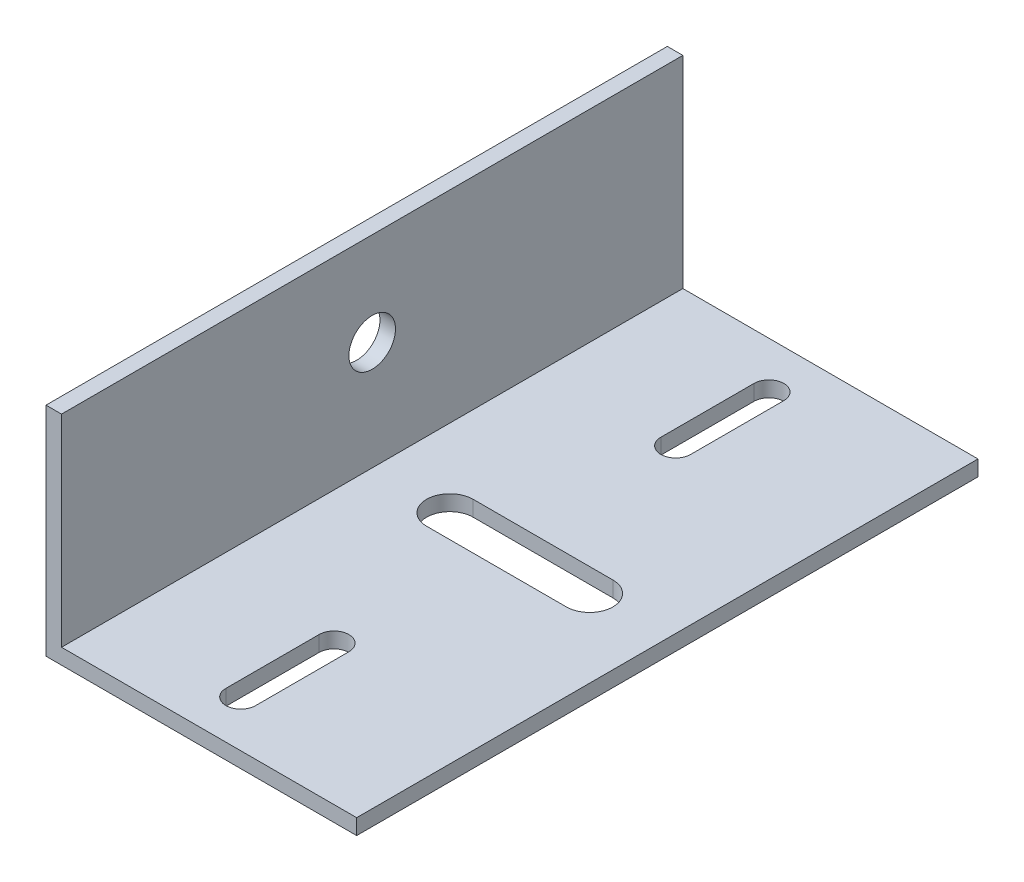
from build123d import *

# Parameters (mm, degrees)
EXTRUDE_1_DEPTH     = 80
CUT_EXTRUDE_1_DEPTH = 10
SKETCH_4_R          = 3
CUT_EXTRUDE_2_DEPTH = 10


with BuildPart() as part:
    # Эскиз2 → Вытянуть-Тонкостенный1 (new body)
    with BuildSketch(Plane.XY):
        Polygon((0, 28), (0, 0), (40, 0), (40, 2), (2, 2), (2, 28), align=None)
    extrude(amount=EXTRUDE_1_DEPTH)

    # Эскиз3 → Вырез-Вытянуть1 (cut)
    with BuildSketch(Plane(origin=(0, 2, 0), x_dir=(1, 0, 0), z_dir=(0, 1, 0))):
        with BuildLine():
            Line((30, -37), (12, -37))
            ThreePointArc((12, -37), (9, -40), (12, -43))
            Line((12, -43), (30, -43))
            ThreePointArc((30, -43), (33, -40), (30, -37))
        make_face()
        with BuildLine():
            Line((17.16, -6), (17.16, -18))
            ThreePointArc((17.16, -18), (19.08, -19.92), (21, -18))
            Line((21, -18), (21, -6))
            ThreePointArc((21, -6), (19.08, -4.08), (17.16, -6))
        make_face()
        with BuildLine():
            Line((21, -74), (21, -62))
            ThreePointArc((21, -62), (19.08, -60.08), (17.16, -62))
            Line((17.16, -62), (17.16, -74))
            ThreePointArc((17.16, -74), (19.08, -75.92), (21, -74))
        make_face()
    extrude(amount=-CUT_EXTRUDE_1_DEPTH, mode=Mode.SUBTRACT)

    # Эскиз4 → Вырез-Вытянуть2 (cut)
    with BuildSketch(Plane.ZY):
        with Locations((40, 16)):
            Circle(SKETCH_4_R)
    extrude(amount=-CUT_EXTRUDE_2_DEPTH, mode=Mode.SUBTRACT)


solid = part.part
